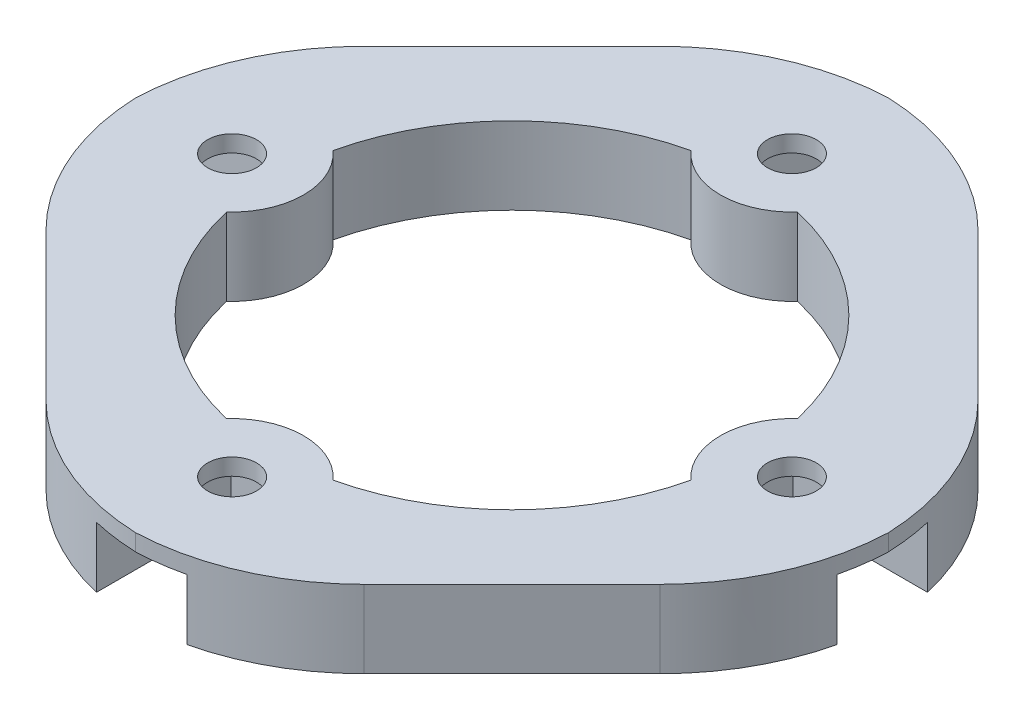
from build123d import *

# Parameters (mm, degrees)
SKETCH1_R           = 65
SKETCH1_R_2         = 40
BOSS_EXTRUDE1_DEPTH = 13
SKETCH2_R           = 4.1
CUT_EXTRUDE1_DEPTH  = 93.838569571
SKETCH8_R           = 12
SKETCH8_R_2         = 4.1
BOSS_EXTRUDE4_DEPTH = 13
SKETCH3_W           = 15.2
SKETCH3_H           = 40
SKETCH3_W_2         = 40
SKETCH3_H_2         = 15.2
CUT_EXTRUDE2_DEPTH  = 10.2
BOSS_EXTRUDE2_DEPTH = 13
FILLET1_R           = 30
BOSS_EXTRUDE3_START = -13
BOSS_EXTRUDE3_DEPTH = 13
CUT_EXTRUDE3_DEPTH  = 93.838569571
FILLET2_R           = 30
SKETCH7_OUTSIDE_W   = 168.862
SKETCH7_OUTSIDE_H   = 168.862
CUT_EXTRUDE4_DEPTH  = 93.838569571
FILLET3_R           = 40


with BuildPart() as part:
    # Sketch1 → Boss-Extrude1 (new body)
    with BuildSketch(Plane(origin=(0, 0, 0), x_dir=(1, 0, 0), z_dir=(0, 1, 0))):
        with Locations(Location((0, 0, 0), (0, 0, 90))):
            Circle(SKETCH1_R)
        with Locations(Location((0, 0, 0), (0, 0, 90))):
            Circle(SKETCH1_R_2, mode=Mode.SUBTRACT)
    extrude(amount=BOSS_EXTRUDE1_DEPTH)

    # Sketch2 → Cut-Extrude1 (cut, through all)
    with BuildSketch(Plane(origin=(0, 13, 0), x_dir=(1, 0, 0), z_dir=(0, 1, 0))):
        with Locations(Location((0, 47, 0), (0, 0, 270))):
            Circle(SKETCH2_R)
        with Locations(Location((47, 0, 0), (0, 0, 270))):
            Circle(SKETCH2_R)
        with Locations(Location((0, -47, 0), (0, 0, 270))):
            Circle(SKETCH2_R)
        with Locations(Location((-47, 0, 0), (0, 0, 270))):
            Circle(SKETCH2_R)
    extrude(amount=-CUT_EXTRUDE1_DEPTH, mode=Mode.SUBTRACT)

    # Sketch8 → Boss-Extrude4 (add)
    # profile 1 of 4: a face of its own
    with BuildSketch(Plane(origin=(0, 13, 0), x_dir=(1, 0, 0), z_dir=(0, 1, 0))):
        with Locations((47, 0)):
            Circle(SKETCH8_R)
        with Locations(Location((47, 0, 0), (0, 0, 270))):
            Circle(SKETCH8_R_2, mode=Mode.SUBTRACT)
    # profile 2 of 4: a face of its own
    with BuildSketch(Plane(origin=(0, 13, 0), x_dir=(1, 0, 0), z_dir=(0, 1, 0))):
        with Locations((0, -47)):
            Circle(SKETCH8_R)
        with Locations(Location((0, -47, 0), (0, 0, 270))):
            Circle(SKETCH8_R_2, mode=Mode.SUBTRACT)
    # profile 3 of 4: a face of its own
    with BuildSketch(Plane(origin=(0, 13, 0), x_dir=(1, 0, 0), z_dir=(0, 1, 0))):
        with Locations((-47, 0)):
            Circle(SKETCH8_R)
        with Locations(Location((-47, 0, 0), (0, 0, 270))):
            Circle(SKETCH8_R_2, mode=Mode.SUBTRACT)
    # profile 4 of 4: a face of its own
    with BuildSketch(Plane(origin=(0, 13, 0), x_dir=(1, 0, 0), z_dir=(0, 1, 0))):
        with Locations((0, 47)):
            Circle(SKETCH8_R)
        with Locations(Location((0, 47, 0), (0, 0, 270))):
            Circle(SKETCH8_R_2, mode=Mode.SUBTRACT)
    extrude(amount=-BOSS_EXTRUDE4_DEPTH)

    # Sketch3 → Cut-Extrude2 (cut)
    with BuildSketch(Plane.XZ):
        with Locations((0, 59.6)):
            Rectangle(SKETCH3_W, SKETCH3_H)
        with Locations((59.6, 0)):
            Rectangle(SKETCH3_W_2, SKETCH3_H_2)
        with Locations((0, -59.6)):
            Rectangle(SKETCH3_W, SKETCH3_H)
        with Locations((-59.6, 0)):
            Rectangle(SKETCH3_W_2, SKETCH3_H_2)
    extrude(amount=-CUT_EXTRUDE2_DEPTH, mode=Mode.SUBTRACT)

    # Sketch4 → Boss-Extrude2 (add)
    with BuildSketch(Plane(origin=(0, 13, 0), x_dir=(1, 0, 0), z_dir=(0, 1, 0))):
        Polygon((-33.587572106, -58.336309448), (-58.336309448, -33.587572106), (-56.639196695, -31.890459353), (-31.890459353, -56.639196695), align=None)
    extrude(amount=-BOSS_EXTRUDE2_DEPTH)

    # Fillet1
    # the kernel refuses this fillet: 30 mm, written as the material it adds along each edge
    with BuildSketch(Plane(origin=(-56.639196695, 13, 31.890459353), x_dir=(-0.43072276652908487, 0, -0.9024842926021104), z_dir=(0, -1, 0))) as fillet1_piece_1:
        with BuildLine():
            CenterArc((10.793469922, -29.931661034), FILLET1_R, 93.868064257, 18.866970785)
            Line((-0.800632502, -2.262602703), (-1.032514551, -1.709221536))
            ThreePointArc((-1.032514551, -1.709221536), (-0.965948102, -0.931149887), (-0.565631851, 0.200151465))
            Line((-0.565631851, 0.200151465), (0.040475512, 0.598633221))
            ThreePointArc((0.040475512, 0.598633221), (4.384847156, 0.451932241), (8.729218799, 0.598633221))
            Line((8.729218799, 0.598633221), (8.769694312, 0))
        make_face()
    extrude(amount=13)
    with BuildSketch(Plane(origin=(-31.890459353, 13, 56.639196695), x_dir=(0.9024842926021067, 0, 0.4307227665290924), z_dir=(0, -1, 0))) as fillet1_piece_2:
        with BuildLine():
            CenterArc((10.793469922, 29.931661034), FILLET1_R, 247.264964958, 18.866970785)
            Line((-0.800632502, 2.262602703), (-1.032514551, 1.709221536))
            ThreePointArc((-1.032514551, 1.709221536), (-0.965948102, 0.931149887), (-0.565631851, -0.200151465))
            Line((-0.565631851, -0.200151465), (0.040475512, -0.598633221))
            ThreePointArc((0.040475512, -0.598633221), (4.384847156, -0.451932241), (8.729218799, -0.598633221))
            Line((8.729218799, -0.598633221), (8.769694312, 0))
        make_face()
    extrude(amount=13)

    # Sketch5 → Boss-Extrude3 (add)
    with BuildSketch(Plane(origin=(0, 13, 0), x_dir=(1, 0, 0), z_dir=(0, 1, 0)).offset(BOSS_EXTRUDE3_START)):
        with BuildLine():
            Line((-31.522820305, 59.213121857), (-29.981916204, 57.672217755))
            ThreePointArc((-29.981916204, 57.672217755), (-34.692861997, 54.825243953), (-39.146042554, 51.589899608))
            Line((-39.146042554, 51.589899608), (-31.522820305, 59.213121857))
        make_face()
        with BuildLine():
            Line((-59.213121857, 31.522820305), (-57.672217755, 29.981916204))
            ThreePointArc((-57.672217755, 29.981916204), (-55.348212032, 34.081892918), (-52.733240933, 38.002701228))
            Line((-52.733240933, 38.002701228), (-59.213121857, 31.522820305))
        make_face()
    extrude(amount=BOSS_EXTRUDE3_DEPTH)

    # Sketch6 → Cut-Extrude3 (cut, through all)
    with BuildSketch(Plane(origin=(0, 13, 0), x_dir=(1, 0, 0), z_dir=(0, 1, 0))):
        Polygon((-31.522820305, 59.213121857), (-59.213121857, 31.522820305), (-61.494356901, 33.80405535), (-33.80405535, 61.494356901), align=None)
    extrude(amount=-CUT_EXTRUDE3_DEPTH, mode=Mode.SUBTRACT)

    # Fillet2
    # the kernel refuses this fillet: 30 mm, written as the material it adds along each edge
    with BuildSketch(Plane(origin=(-57.672217755, 0, -29.981916204), x_dir=(-0.4036365927453583, 0, 0.9149193959015831), z_dir=(0, 1, 0))) as fillet2_piece_1:
        with BuildLine():
            CenterArc((10.221339545, -29.938721136), FILLET2_R, 93.662741819, 17.866287174)
            Line((-0.787837769, -2.031768331), (-1.008021315, -1.473629275))
            ThreePointArc((-1.008021315, -1.473629275), (-0.953334813, -0.798965243), (-0.559415929, 0.216918922))
            Line((-0.559415929, 0.216918922), (0.038330023, 0.598774423))
            ThreePointArc((0.038330023, 0.598774423), (4.15241919, 0.467229129), (8.266508357, 0.598774423))
            Line((8.266508357, 0.598774423), (8.304838381, 0))
        make_face()
    extrude(amount=13)
    with BuildSketch(Plane(origin=(-29.981916204, 0, -57.672217755), x_dir=(-0.7071067811865491, 0, -0.7071067811865459), z_dir=(0, 1, 0))) as fillet2_piece_2:
        with BuildLine():
            CenterArc((24.218325876, -20.353758796), FILLET2_R, 137.276688213, 17.866287174)
            Line((-3.002460986, -7.743098124), (-3.546876723, -7.49088491))
            ThreePointArc((-3.546876723, -7.49088491), (-1.936856188, -3.702630997), (-0.572130762, 0.180738462))
            Line((-0.572130762, 0.180738462), (0, 0.6))
            ThreePointArc((0, 0.6), (1.089583739, 0.6), (1.738384311, 0.407075176))
            Line((1.738384311, 0.407075176), (2.179167479, 0))
        make_face()
    extrude(amount=13)

    # Sketch7 outside → Cut-Extrude4 (cut, through all)
    with BuildSketch(Plane(origin=(0, 13, 0), x_dir=(1, 0, 0), z_dir=(0, 1, 0))):
        Rectangle(SKETCH7_OUTSIDE_W, SKETCH7_OUTSIDE_H)
        Polygon((63.245553203, -15), (15, -63.245553203), (-15, -63.245553203), (-63.245553203, -15), (-63.245553203, 15), (-15, 63.245553203), (15, 63.245553203), (63.245553203, 15), align=None, mode=Mode.SUBTRACT)
    extrude(amount=-CUT_EXTRUDE4_DEPTH, mode=Mode.SUBTRACT)

    # Fillet3
    # the kernel refuses this fillet: 40 mm, written as the material it takes off along each edge
    with BuildSketch(Plane(origin=(15, 54.421356237, 63.245553203), x_dir=(-1, 0, 0), z_dir=(0, -1, 0)), Plane(origin=(-15, 54.421356237, 63.245553203), x_dir=(-0.7071067811865475, 0, -0.7071067811865477), z_dir=(0, -1, 0)), Plane(origin=(-63.245553203, 54.421356237, 15), x_dir=(0, 0, -1), z_dir=(0, -1, 0)), Plane(origin=(-63.245553203, 54.421356237, -15), x_dir=(0.7071067811865477, 0, -0.7071067811865475), z_dir=(0, -1, 0)), Plane(origin=(63.245553203, 54.421356237, 15), x_dir=(-0.7071067811865477, 0, 0.7071067811865475), z_dir=(0, -1, 0)), Plane(origin=(63.245553203, 54.421356237, -15), x_dir=(0, 0, 1), z_dir=(0, -1, 0))) as fillet3_piece_1:
        with BuildLine():
            CenterArc((FILLET3_R * 0.414213562373, FILLET3_R), FILLET3_R, 225, 45)
            Line((-FILLET3_R * 0.292893218813, FILLET3_R * 0.292893218813), (0, 0))
            Line((0, 0), (FILLET3_R * 0.414213562373, 0))
        make_face()
    extrude(amount=95.842712475, mode=Mode.SUBTRACT)
    with BuildSketch(Plane(origin=(-15, 54.421356237, -63.245553203), x_dir=(-0.7071067811865476, 0, 0.7071067811865476), z_dir=(0, -1, 0)), Plane(origin=(15, 54.421356237, -63.245553203), x_dir=(-1, 0, 0), z_dir=(0, -1, 0))) as fillet3_piece_2:
        with BuildLine():
            CenterArc((FILLET3_R * 0.414213562373, -FILLET3_R), FILLET3_R, 90, 45)
            Line((-FILLET3_R * 0.292893218813, -FILLET3_R * 0.292893218813), (0, 0))
            Line((0, 0), (FILLET3_R * 0.414213562373, 0))
        make_face()
    extrude(amount=95.842712475, mode=Mode.SUBTRACT)


solid = part.part
